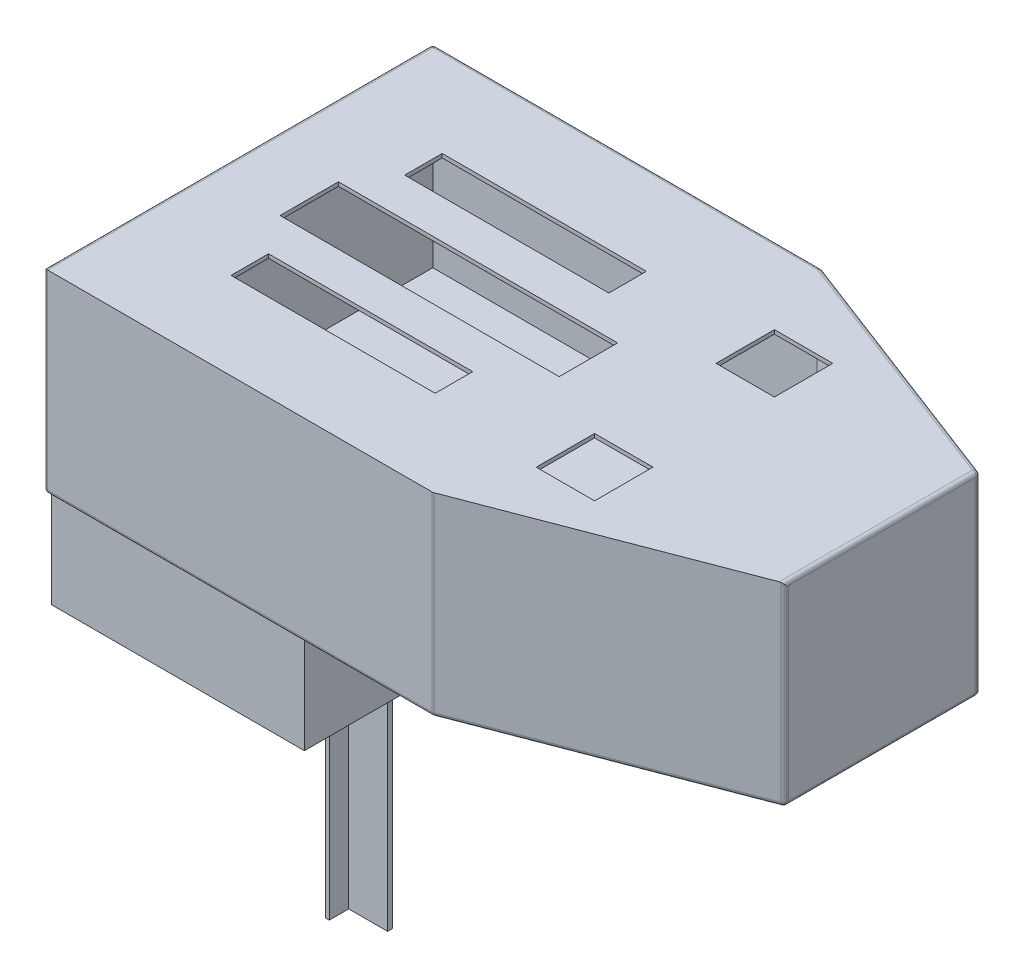
from build123d import *

# Parameters (mm, degrees)
BOSS_EXTRUDE1_DEPTH  = 25
SHELL1_T             = -1
BOSS_EXTRUDE5_START  = 139.610288
SKETCH2_W            = 47.858786484
SKETCH2_H            = 48
BOSS_EXTRUDE5_DEPTH  = 1
BOSS_EXTRUDE6_START  = -25.773196
SKETCH3_W            = 98
SKETCH3_H            = 48
BOSS_EXTRUDE6_DEPTH  = 1
FILLET1_R            = 1
CUT_EXTRUDE1_START   = 25
SKETCH4_W            = 71.73360049
SKETCH4_H            = 15
CUT_EXTRUDE1_DEPTH   = 1
CUT_EXTRUDE3_START   = 25
SKETCH5_W            = 15
SKETCH5_H            = 15
CUT_EXTRUDE3_DEPTH   = 1
SKETCH7_W            = 65
SKETCH7_H            = 98
BOSS_EXTRUDE8_DEPTH  = 25
BOSS_EXTRUDE10_START = 25
SKETCH6_W            = 1
SKETCH6_H            = 10
BOSS_EXTRUDE10_DEPTH = 75
SKETCH8_W            = 10
SKETCH8_H            = 1.292837184
BOSS_EXTRUDE11_DEPTH = 75
SKETCH9_W            = 52.469950821
SKETCH9_H            = 9.638623322
CUT_EXTRUDE4_DEPTH   = 1


with BuildPart() as part:
    # Sketch1 → Boss-Extrude1 (new, symmetric)
    with BuildSketch(Plane(origin=(0, 0, 0), x_dir=(1, 0, 0), z_dir=(0, 1, 0))):
        Polygon((74.226804124, 57.731958763), (139.610288277, 32.731958763), (139.610288277, -17.268041237), (74.226804124, -42.268041237), (-25.773195876, -42.268041237), (-25.773195876, 57.731958763), align=None)
    extrude(amount=BOSS_EXTRUDE1_DEPTH, both=True)

    # Shell1
    shell1_openings = [part.faces().sort_by_distance(p)[0] for p in [
        (139.610288277, 0, -7.731958763),
        (-25.773195876, 0, -7.731958763),
    ]]
    offset(amount=SHELL1_T, openings=shell1_openings, kind=Kind.INTERSECTION)

    # Sketch3 → Boss-Extrude6 (add)
    with BuildSketch(Plane(origin=(0, 0, 0), x_dir=(0, 0, -1), z_dir=(1, 0, 0)).offset(BOSS_EXTRUDE6_START)):
        with Locations((7.731958763, 0)):
            Rectangle(SKETCH3_W, SKETCH3_H)
    extrude(amount=BOSS_EXTRUDE6_DEPTH)

    # Fillet1
    fillet1_edges = [part.edges().sort_by_distance(p)[0] for p in [
        (-25.773195876, 0, -57.731958763),
        (74.226804124, 0, -57.731958763),
        (139.610288277, 0, -32.731958763),
        (139.610288277, 0, 17.268041237),
        (74.226804124, 0, 42.268041237),
        (-25.773195876, 0, 42.268041237),
        (139.610288277, 25, -7.731958763),
        (106.9185462, 25, -45.231958763),
        (74.04214349, 0, -56.731958763),
        (24.226804124, 25, -57.731958763),
        (106.826215883, 24, 28.732737858),
        (24.634473745, 24, 41.268041237),
        (-25.773195876, 25, -7.731958763),
        (24.226804124, -25, -57.731958763),
        (106.9185462, -25, -45.231958763),
        (139.610288277, -25, -7.731958763),
        (106.9185462, -25, 29.768041237),
        (24.226804124, -25, 42.268041237),
        (-25.773195876, -25, -7.731958763),
    ]]
    fillet(fillet1_edges, radius=FILLET1_R - 0.0001)  # a hair under: the kernel refuses the full size

    # Sketch4 → Cut-Extrude1 (cut)
    with BuildSketch(Plane(origin=(0, 0, 0), x_dir=(1, 0, 0), z_dir=(0, 1, 0)).offset(CUT_EXTRUDE1_START)):
        with Locations((28.836787869, 7.231958763)):
            Rectangle(SKETCH4_W, SKETCH4_H)
    extrude(amount=-CUT_EXTRUDE1_DEPTH, mode=Mode.SUBTRACT)

    # Sketch5 → Cut-Extrude3 (cut)
    with BuildSketch(Plane(origin=(0, 0, 0), x_dir=(1, 0, 0), z_dir=(0, 1, 0)).offset(CUT_EXTRUDE3_START)):
        with Locations((89.396495287, 30.342973194)):
            Rectangle(SKETCH5_W, SKETCH5_H)
        with Locations((89.396495287, -15.863127894)):
            Rectangle(SKETCH5_W, SKETCH5_H)
    extrude(amount=-CUT_EXTRUDE3_DEPTH, mode=Mode.SUBTRACT)

    # Sketch7 → Boss-Extrude8 (add)
    with BuildSketch(Plane.XZ.offset(25)):
        with Locations((7.726804124, -7.731958763)):
            Rectangle(SKETCH7_W, SKETCH7_H)
    extrude(amount=BOSS_EXTRUDE8_DEPTH)

    # Sketch6 → Boss-Extrude10 (add)
    with BuildSketch(Plane.XZ.offset(25).offset(BOSS_EXTRUDE10_START)):
        with Locations((5.630415621, -4.214823889)):
            Rectangle(SKETCH6_W, SKETCH6_H)
    extrude(amount=BOSS_EXTRUDE10_DEPTH)

    # Sketch8 → Boss-Extrude11 (add)
    with BuildSketch(Plane.XZ.offset(50)):
        with Locations((11.130415621, -4.861242481)):
            Rectangle(SKETCH8_W, SKETCH8_H)
    extrude(amount=BOSS_EXTRUDE11_DEPTH)

    # Sketch9 → Cut-Extrude4 (cut)
    with BuildSketch(Plane(origin=(0, 25, 0), x_dir=(1, 0, 0), z_dir=(0, 1, 0))):
        with Locations((26.234975411, 29.551270424)):
            Rectangle(SKETCH9_W, SKETCH9_H)
        with Locations((26.234975411, -15.087352898)):
            Rectangle(SKETCH9_W, SKETCH9_H)
    extrude(amount=-CUT_EXTRUDE4_DEPTH, mode=Mode.SUBTRACT)


with BuildPart() as body_2:
    # Sketch2 → Boss-Extrude5 (new body)
    with BuildSketch(Plane(origin=(0, 0, 0), x_dir=(0, 0, -1), z_dir=(1, 0, 0)).offset(BOSS_EXTRUDE5_START)):
        with Locations((7.731958763, 0)):
            Rectangle(SKETCH2_W, SKETCH2_H)
    extrude(amount=-BOSS_EXTRUDE5_DEPTH)


solid = Compound([part.part, body_2.part])
